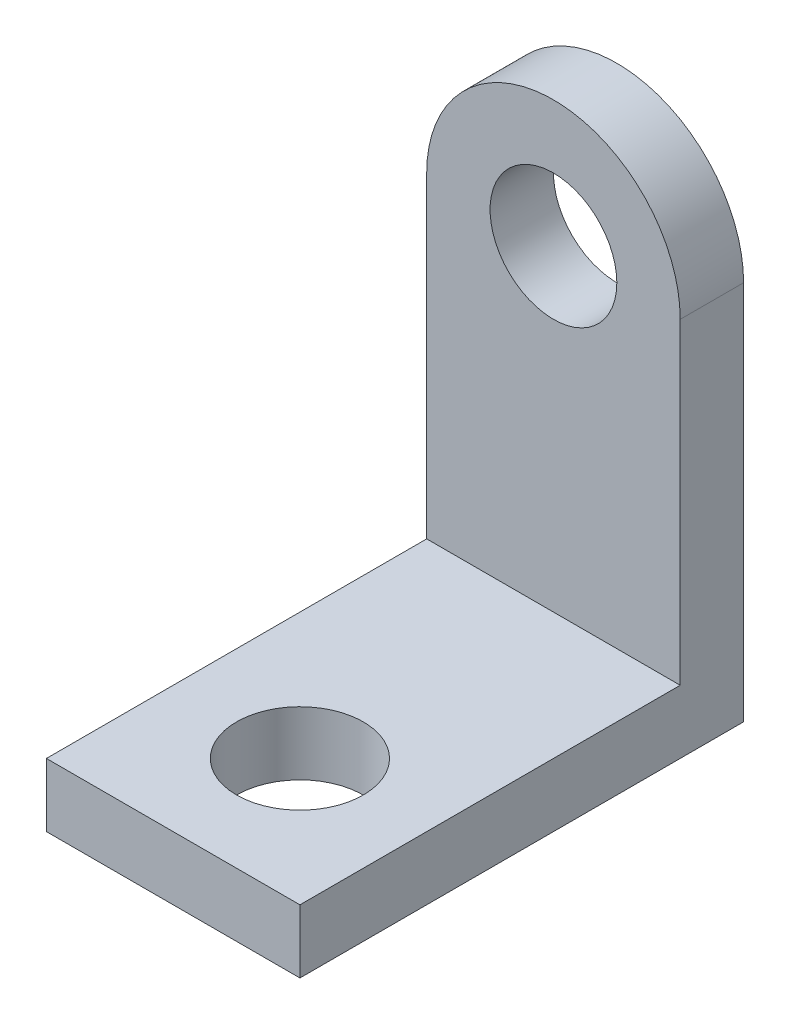
from build123d import *

# Parameters (mm, degrees)
SKETCH1_R           = 3.175
BOSS_EXTRUDE1_DEPTH = 3.175
SKETCH2_W           = 12.7
SKETCH2_H           = 3.175
BOSS_EXTRUDE2_DEPTH = 19.05
SKETCH3_R           = 3.175
CUT_EXTRUDE1_DEPTH  = 19.05


with BuildPart() as part:
    # Sketch1 → Boss-Extrude1 (new body)
    with BuildSketch(Plane.XY):
        with BuildLine():
            Line((-6.35, 0), (-6.35, -19.05))
            Line((-6.35, -19.05), (6.35, -19.05))
            Line((6.35, -19.05), (6.35, 0))
            ThreePointArc((6.35, 0), (0, 6.35), (-6.35, 0))
        make_face()
        Circle(SKETCH1_R, mode=Mode.SUBTRACT)
    extrude(amount=BOSS_EXTRUDE1_DEPTH)

    # Sketch2 → Boss-Extrude2 (add)
    with BuildSketch(Plane.XY.offset(3.175)):
        with Locations((0, -17.4625)):
            Rectangle(SKETCH2_W, SKETCH2_H)
    extrude(amount=BOSS_EXTRUDE2_DEPTH)

    # Sketch3 → Cut-Extrude1 (cut)
    with BuildSketch(Plane(origin=(0, -15.875, 0), x_dir=(1, 0, 0), z_dir=(0, 1, 0))):
        with Locations((0, -15.875)):
            Circle(SKETCH3_R)
    extrude(amount=-CUT_EXTRUDE1_DEPTH, mode=Mode.SUBTRACT)


solid = part.part
